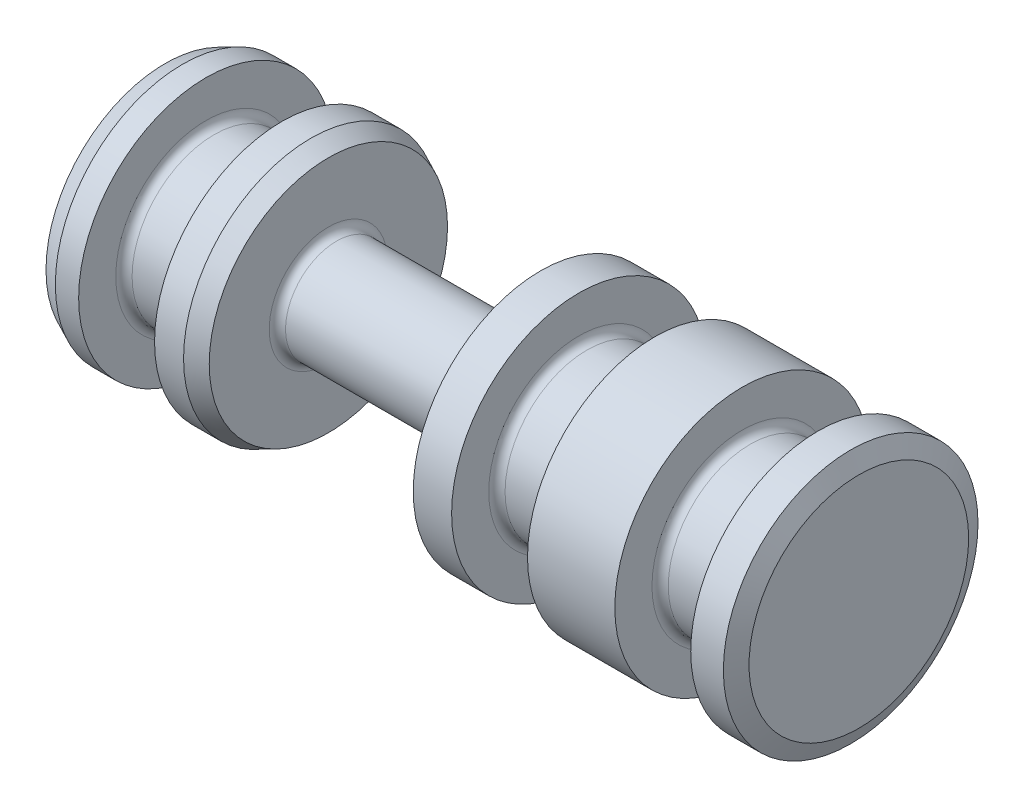
from build123d import *
from OCP.BRepFilletAPI import BRepFilletAPI_MakeChamfer

# Parameters (mm, degrees)
SKETCH1_R           = 3.9624
BOSS_EXTRUDE1_DEPTH = 21.59
SKETCH2_W           = 2.3622
SKETCH2_H           = 1.4097
SKETCH2_W_2         = 6.35
SKETCH2_H_2         = 2.3749
FILLET1_R           = 0.254
CHAMFER1_SIZE       = 0.254
CHAMFER1_SIZE2      = 0.544704758


with BuildPart() as part:
    # Sketch1 → Boss-Extrude1 (new body)
    with BuildSketch(Plane(origin=(0, 0, 0), x_dir=(0, 0, -1), z_dir=(1, 0, 0))):
        Circle(SKETCH1_R)
    extrude(amount=BOSS_EXTRUDE1_DEPTH)

    # Sketch2 → Cut-Revolve1 (revolve, cut)
    with BuildSketch(Plane.XY):
        with Locations((2.4511, 3.25755)):
            Rectangle(SKETCH2_W, SKETCH2_H)
        with Locations((19.1389, 3.25755)):
            Rectangle(SKETCH2_W, SKETCH2_H)
        with Locations((14.0589, 3.25755)):
            Rectangle(SKETCH2_W, SKETCH2_H)
        with Locations((8.255, 2.77495)):
            Rectangle(SKETCH2_W_2, SKETCH2_H_2)
    revolve(axis=Axis((-1.617419624, 0, 0), (1, 0, 0)), mode=Mode.SUBTRACT)

    # Fillet1
    fillet1_edges = [part.edges().sort_by_distance(p)[0] for p in [
        (20.32, -2.5527, 0),
        (17.9578, -2.5527, 0),
        (15.24, -2.5527, 0),
        (12.8778, -2.5527, 0),
        (11.43, -1.5875, 0),
        (5.08, -1.5875, 0),
        (3.6322, -2.5527, 0),
        (1.27, -2.5527, 0),
    ]]
    fillet(fillet1_edges, radius=FILLET1_R)

    # Chamfer1: one chamfer whose edges measure the first distance from different faces: ONE call of the kernel's chamfer builder (chamfer() names one face for all edges)
    chamfer1_edges_1 = [part.edges().sort_by_distance(p)[0] for p in [
        (21.59, 0, 3.9624),
    ]]
    chamfer1_side_1 = [part.faces().sort_by_distance(p)[0] for p in [
        (20.955, 0, 3.9624),
    ]]
    chamfer1_edges_2 = [part.edges().sort_by_distance(p)[0] for p in [
        (11.43, 0, 3.9624),
    ]]
    chamfer1_side_2 = [part.faces().sort_by_distance(p)[0] for p in [
        (12.1539, 0, 3.9624),
    ]]
    chamfer1_edges_3 = [part.edges().sort_by_distance(p)[0] for p in [
        (5.08, 0, 3.9624),
    ]]
    chamfer1_side_3 = [part.faces().sort_by_distance(p)[0] for p in [
        (5.08, -1.953573596, 0),
    ]]
    chamfer1_edges_4 = [part.edges().sort_by_distance(p)[0] for p in [
        (0, 0, 3.9624),
    ]]
    chamfer1_side_4 = [part.faces().sort_by_distance(p)[0] for p in [
        (0, 0, 0),
    ]]
    chamfer1 = BRepFilletAPI_MakeChamfer(part.part.solid().wrapped)
    for e in chamfer1_edges_1:
        chamfer1.Add(CHAMFER1_SIZE, CHAMFER1_SIZE2, e.wrapped, chamfer1_side_1[0].wrapped)  # the first distance lies on this face
    for e in chamfer1_edges_2:
        chamfer1.Add(CHAMFER1_SIZE, CHAMFER1_SIZE2, e.wrapped, chamfer1_side_2[0].wrapped)  # the first distance lies on this face
    for e in chamfer1_edges_3:
        chamfer1.Add(CHAMFER1_SIZE, CHAMFER1_SIZE2, e.wrapped, chamfer1_side_3[0].wrapped)  # the first distance lies on this face
    for e in chamfer1_edges_4:
        chamfer1.Add(CHAMFER1_SIZE, CHAMFER1_SIZE2, e.wrapped, chamfer1_side_4[0].wrapped)  # the first distance lies on this face
    add(Compound.cast(chamfer1.Shape()), mode=Mode.REPLACE)


solid = part.part
